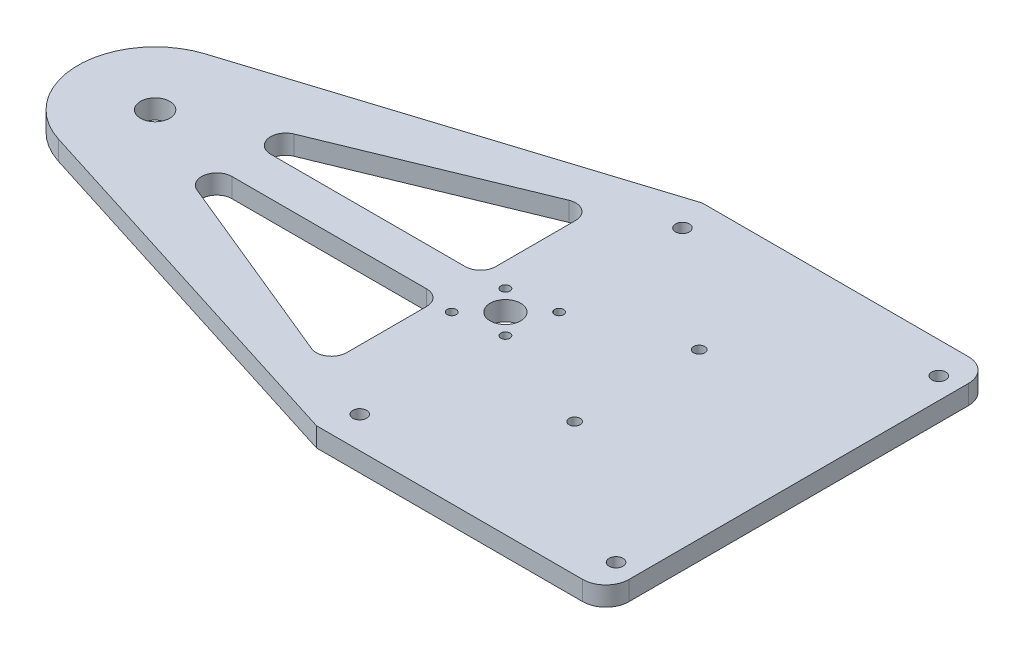
from build123d import *

# Parameters (mm, degrees)
SKETCH1_W           = 95.25
SKETCH1_H           = 127
BOSS_EXTRUDE1_DEPTH = 6.35
BOSS_EXTRUDE3_DEPTH = 6.35
SKETCH5_R           = 4.826
SKETCH5_R_2         = 5.039999953
SKETCH5_R_3         = 1.5
CUT_EXTRUDE1_DEPTH  = 201.11039673
CUT_EXTRUDE2_DEPTH  = 201.11039673
FILLET9_R           = 5
FILLET10_R          = 7.62
SKETCH7_R           = 2.2812375
CUT_EXTRUDE3_DEPTH  = 201.11039673
SKETCH8_R           = 1.830008083
CUT_EXTRUDE4_DEPTH  = 201.11039673


with BuildPart() as part:
    # Sketch1 → Boss-Extrude1 (new body)
    with BuildSketch(Plane(origin=(0, 0, 0), x_dir=(1, 0, 0), z_dir=(0, 1, 0))):
        Rectangle(SKETCH1_W, SKETCH1_H)
    extrude(amount=BOSS_EXTRUDE1_DEPTH)

    # Sketch4 → Boss-Extrude3 (add)
    with BuildSketch(Plane(origin=(0, 6.35, 0), x_dir=(1, 0, 0), z_dir=(0, 1, 0))):
        with BuildLine():
            Line((-47.625, 63.5), (-171.916018217, 24.219268021))
            ThreePointArc((-171.916018217, 24.219268021), (-189.6618, 0), (-171.916018217, -24.219268021))
            Line((-171.916018217, -24.219268021), (-47.625, -63.5))
            Line((-47.625, -63.5), (-47.625, 63.5))
        make_face()
    extrude(amount=-BOSS_EXTRUDE3_DEPTH)

    # Sketch5 → Cut-Extrude1 (cut, through all)
    with BuildSketch(Plane(origin=(0, 6.35, 0), x_dir=(1, 0, 0), z_dir=(0, 1, 0))):
        with Locations((-164.2618, 0)):
            Circle(SKETCH5_R)
        with Locations((-48.9458, 0)):
            Circle(SKETCH5_R_2)
        with Locations((-42.228285579, -6.717514421)):
            Circle(SKETCH5_R_3)
        with Locations((-40.106965235, 8.838834765)):
            Circle(SKETCH5_R_3)
        with Locations((-57.784634765, -8.838834765)):
            Circle(SKETCH5_R_3)
        with Locations((-55.663314421, 6.717514421)):
            Circle(SKETCH5_R_3)
    extrude(amount=-CUT_EXTRUDE1_DEPTH, mode=Mode.SUBTRACT)

    # Sketch6 → Cut-Extrude2 (cut, through all)
    with BuildSketch(Plane(origin=(0, 6.35, 0), x_dir=(1, 0, 0), z_dir=(0, 1, 0))):
        Polygon((-63.5, 45.163743355), (-157.9118, 6.35), (-63.5, 6.35), align=None)
        Polygon((-63.5, -6.35), (-63.5, -45.163743355), (-157.9118, -6.35), align=None)
    extrude(amount=-CUT_EXTRUDE2_DEPTH, mode=Mode.SUBTRACT)

    # Fillet9
    fillet9_edges = [part.edges().sort_by_distance(p)[0] for p in [
        (-157.9118, 3.175, 6.35),
        (-63.5, 3.175, 6.35),
        (-63.5, 3.175, 45.163743355),
        (-63.5, 3.175, -6.35),
        (-157.9118, 3.175, -6.35),
        (-63.5, 3.175, -45.163743355),
    ]]
    fillet(fillet9_edges, radius=FILLET9_R)

    # Fillet10
    fillet10_edges = [part.edges().sort_by_distance(p)[0] for p in [
        (47.625, 3.175, -63.5),
        (47.625, 3.175, 63.5),
    ]]
    fillet(fillet10_edges, radius=FILLET10_R)

    # Sketch7 → Cut-Extrude3 (cut, through all)
    with BuildSketch(Plane(origin=(0, 6.35, 0), x_dir=(1, 0, 0), z_dir=(0, 1, 0))):
        with Locations((-43.777254611, -53.125383493)):
            Circle(SKETCH7_R)
        with Locations((-43.777254611, 53.125383493)):
            Circle(SKETCH7_R)
        with Locations((40.602254611, 53.125383493)):
            Circle(SKETCH7_R)
        with Locations((40.602254611, -53.125383493)):
            Circle(SKETCH7_R)
    extrude(amount=-CUT_EXTRUDE3_DEPTH, mode=Mode.SUBTRACT)

    # Sketch8 → Cut-Extrude4 (cut, through all)
    with BuildSketch(Plane(origin=(0, 6.35, 0), x_dir=(1, 0, 0), z_dir=(0, 1, 0))):
        with Locations((-6.328465047, -19.828924843)):
            Circle(SKETCH8_R)
        with Locations((-6.328338046, 21.171490961)):
            Circle(SKETCH8_R)
    extrude(amount=-CUT_EXTRUDE4_DEPTH, mode=Mode.SUBTRACT)


solid = part.part
